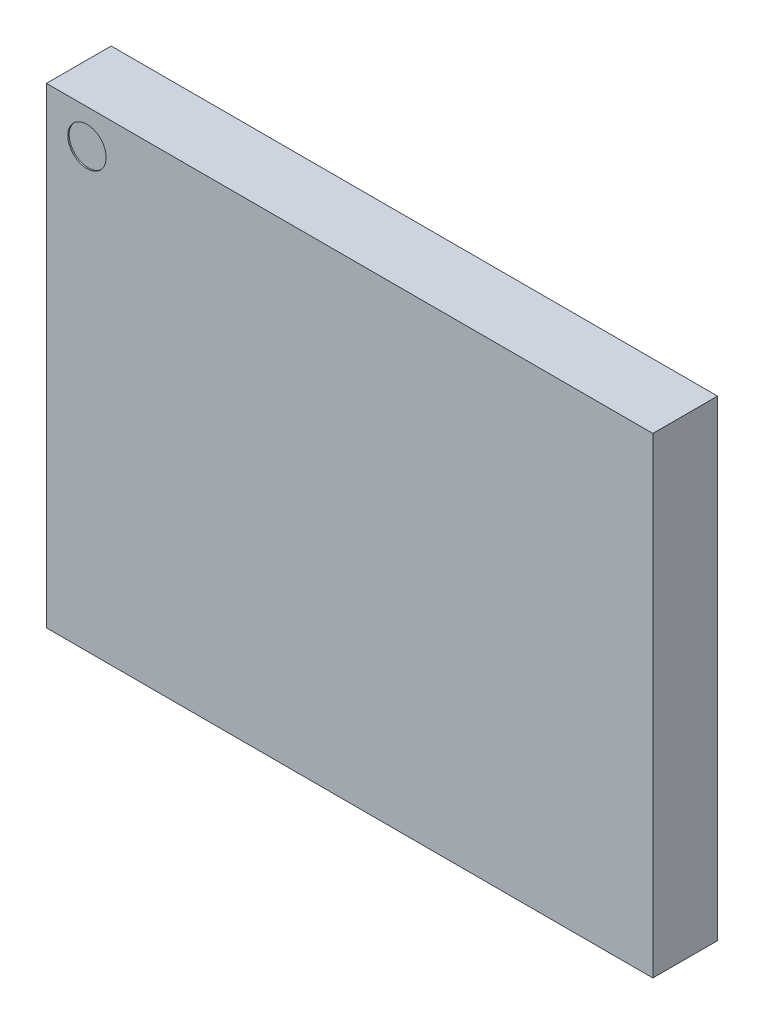
from build123d import *

# Parameters (mm, degrees)
SKETCH1_W            = 9
SKETCH1_H            = 7
BOSS_EXTRUDE1_DEPTH  = 0.96
LPATTERN1_COUNT      = 17
LPATTERN1_PITCH      = 0.5
LPATTERN1_COUNT_DIR2 = 13
LPATTERN1_PITCH_DIR2 = 0.5
SKETCH4_R            = 0.284698622
CUT_EXTRUDE1_DEPTH   = 0.02


with BuildPart() as part:
    # Sketch1 → Boss-Extrude1 (new body)
    with BuildSketch(Plane.XY):
        Rectangle(SKETCH1_W, SKETCH1_H)
    extrude(amount=BOSS_EXTRUDE1_DEPTH)

    # Sketch3 → Revolve1 (revolve)
    with BuildSketch(Plane(origin=(0, 3, 0), x_dir=(1, 0, 0), z_dir=(0, 1, 0))):
        with BuildLine():
            Line((4, 0), (4.09, 0))
            ThreePointArc((4.09, 0), (4.142302495, 0.167434165), (4, 0.27))
            Line((4, 0.27), (4, 0))
        make_face()
    revolve1 = revolve(axis=Axis((4, 3, 0), (0, 0, -1)))

    # LPattern1: Revolve1 17 × 13, 117 skipped
    with Locations(*[(-i * LPATTERN1_PITCH, -j * LPATTERN1_PITCH_DIR2, 0) for i in range(LPATTERN1_COUNT) for j in range(LPATTERN1_COUNT_DIR2) if (i, j) not in ((0, 0), (2, 2), (2, 3), (2, 4), (2, 5), (2, 6), (2, 7), (2, 8), (2, 9), (2, 10), (3, 2), (3, 3), (3, 4), (3, 5), (3, 6), (3, 7), (3, 8), (3, 9), (3, 10), (4, 2), (4, 3), (4, 4), (4, 5), (4, 6), (4, 7), (4, 8), (4, 9), (4, 10), (5, 2), (5, 3), (5, 4), (5, 5), (5, 6), (5, 7), (5, 8), (5, 9), (5, 10), (6, 2), (6, 3), (6, 4), (6, 5), (6, 6), (6, 7), (6, 8), (6, 9), (6, 10), (7, 2), (7, 3), (7, 4), (7, 5), (7, 6), (7, 7), (7, 8), (7, 9), (7, 10), (8, 2), (8, 3), (8, 4), (8, 5), (8, 6), (8, 7), (8, 8), (8, 9), (8, 10), (9, 2), (9, 3), (9, 4), (9, 5), (9, 6), (9, 7), (9, 8), (9, 9), (9, 10), (10, 2), (10, 3), (10, 4), (10, 5), (10, 6), (10, 7), (10, 8), (10, 9), (10, 10), (11, 2), (11, 3), (11, 4), (11, 5), (11, 6), (11, 7), (11, 8), (11, 9), (11, 10), (12, 2), (12, 3), (12, 4), (12, 5), (12, 6), (12, 7), (12, 8), (12, 9), (12, 10), (13, 2), (13, 3), (13, 4), (13, 5), (13, 6), (13, 7), (13, 8), (13, 9), (13, 10), (14, 2), (14, 3), (14, 4), (14, 5), (14, 6), (14, 7), (14, 8), (14, 9), (14, 10))]):
        add(revolve1)

    # Sketch4 → Cut-Extrude1 (cut)
    with BuildSketch(Plane.XY.offset(0.96)):
        with Locations((-3.898823508, 2.988959518)):
            Circle(SKETCH4_R)
    extrude(amount=-CUT_EXTRUDE1_DEPTH, mode=Mode.SUBTRACT)


solid = part.part
